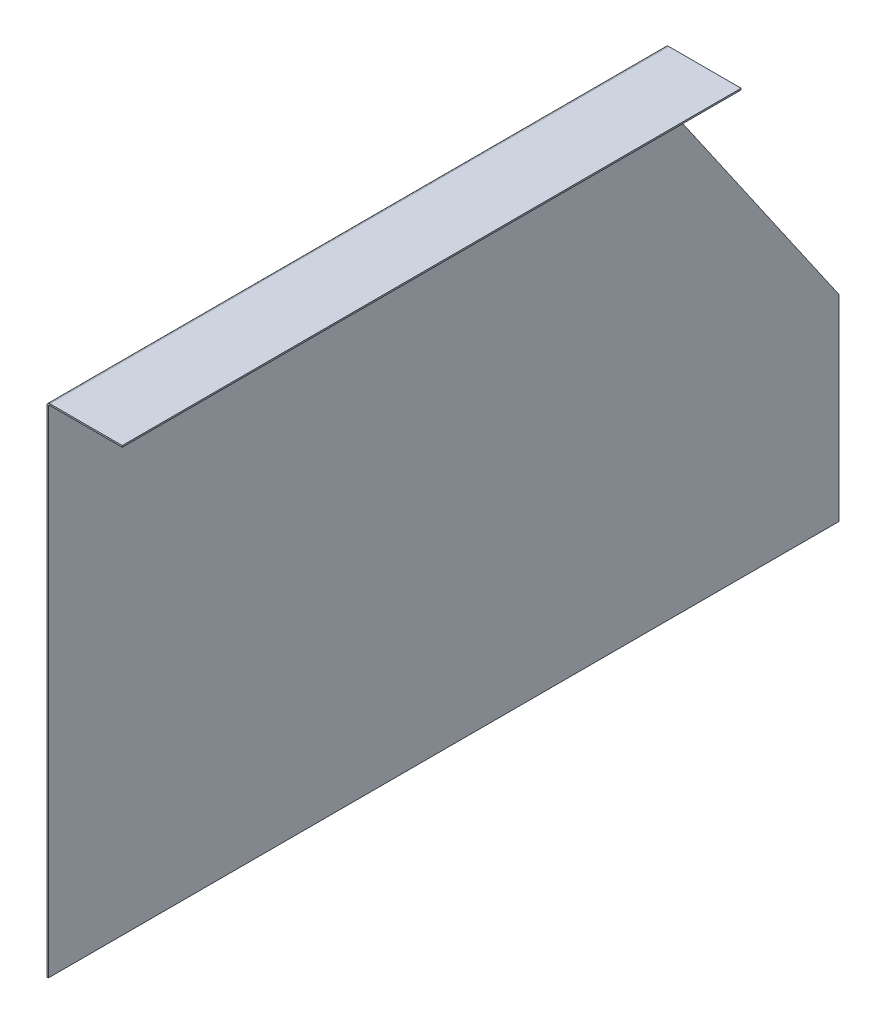
from build123d import *

# Parameters (mm, degrees)
EXTRUDE_1_DEPTH                  = 1
SM_EDGE_FLANGE_1_STRIP_W         = 6
SM_EDGE_FLANGE_1_STRIP_H         = 1
SM_EDGE_FLANGE_1_STRIP_CUT_DEPTH = 410
SM_EDGE_FLANGE_1_DEPTH           = 410


# Sheet-metal steps are written as plain solids
with BuildPart() as part:
    # Sketch 1 → Бобышка-Вытянуть1 (new body)
    with BuildSketch(Plane(origin=(0, 0, 0), x_dir=(0, 0, -1), z_dir=(1, 0, 0))):
        Polygon((-262, -165), (262, -165), (262, -35), (148, 130), (148, 165), (-262, 165), align=None)
    extrude(amount=EXTRUDE_1_DEPTH)

    # Ребро-кромка1 strip (across the edge) → Ребро-кромка1 strip cut (cut)
    with BuildSketch(Plane(origin=(1, 165, -148), x_dir=(0, -1, 0), z_dir=(0, 0, 1))):
        with Locations((-1, -0.5)):
            Rectangle(SM_EDGE_FLANGE_1_STRIP_W, SM_EDGE_FLANGE_1_STRIP_H)
    extrude(amount=SM_EDGE_FLANGE_1_STRIP_CUT_DEPTH, mode=Mode.SUBTRACT)

    # Ребро-кромка1 section (across the edge) → Ребро-кромка1 (add)
    with BuildSketch(Plane(origin=(1, 165, -148), x_dir=(0, -1, 0), z_dir=(0, 0, 1))):
        with BuildLine():
            Line((0, 1), (0, 49))
            Line((0, 49), (1, 49))
            Line((1, 49), (1, 1))
            ThreePointArc((1, 1), (1.292893219, 0.292893219), (2, 0))
            Line((2, 0), (2, -1))
            ThreePointArc((2, -1), (0.585786438, -0.414213562), (0, 1))
        make_face()
    extrude(amount=SM_EDGE_FLANGE_1_DEPTH)


solid = part.part
